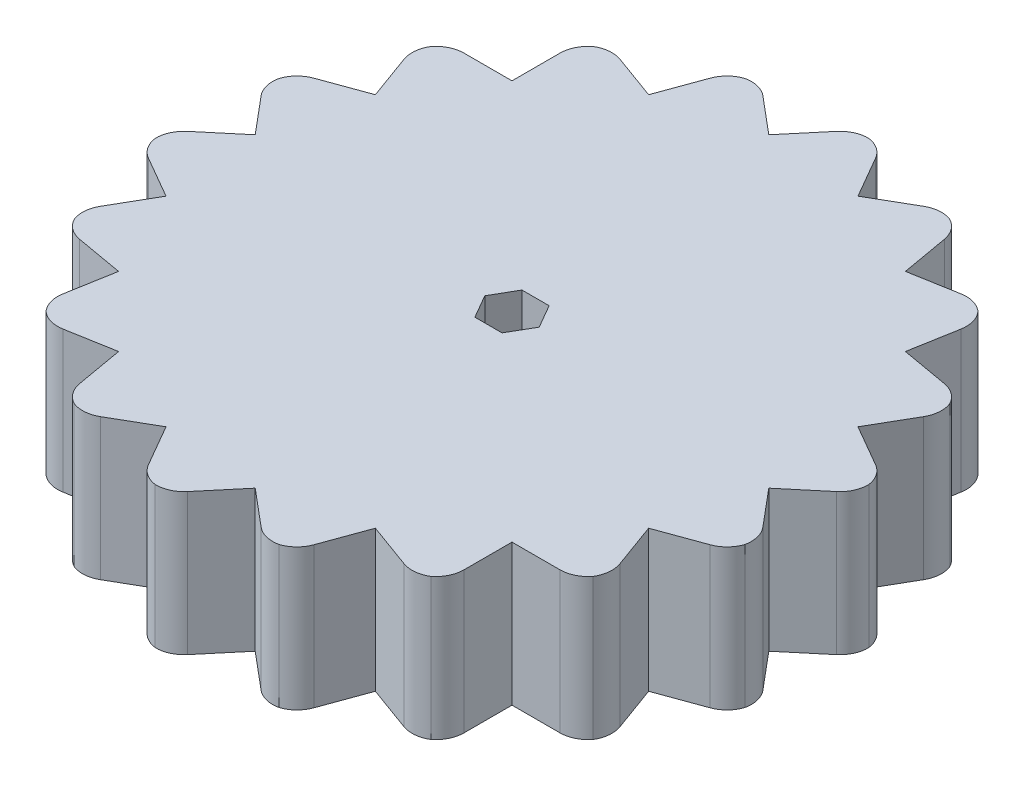
from build123d import *

# Parameters (mm, degrees)
SKETCH1_R           = 44.45
BOSS_EXTRUDE1_DEPTH = 19.05
SKETCH2_W           = 8.414535341
SKETCH2_H           = 8.414535341
CUT_EXTRUDE1_DEPTH  = 29.972
CIRPATTERN1_COUNT   = 18
CUT_EXTRUDE2_DEPTH  = 6.35
FILLET3_R           = 3.81
CUT_EXTRUDE6_DEPTH  = 25.908


with BuildPart() as part:
    # Sketch1 → Boss-Extrude1 (new body)
    with BuildSketch(Plane(origin=(0, 0, 0), x_dir=(1, 0, 0), z_dir=(0, 1, 0))):
        with Locations(Location((0, 0, 0), (0, 0, 270))):
            Circle(SKETCH1_R)
    extrude(amount=BOSS_EXTRUDE1_DEPTH)

    # Sketch2 → Cut-Extrude1 (cut)
    with BuildSketch(Plane(origin=(0, 19.05, 0), x_dir=(1, 0, 0), z_dir=(0, 1, 0))):
        with Locations((-31.148036033, 31.148036033)):
            Rectangle(SKETCH2_W, SKETCH2_H)
    cut_extrude1 = extrude(amount=-CUT_EXTRUDE1_DEPTH, mode=Mode.SUBTRACT)

    # CirPattern1: Cut-Extrude1 ×18 about axis
    cirpattern1_axis = Axis((0, 0, 0), (0, 1, 0))
    for i in range(1, CIRPATTERN1_COUNT):
        add(cut_extrude1.rotate(cirpattern1_axis, i * 360 / CIRPATTERN1_COUNT), mode=Mode.SUBTRACT)

    # Sketch4 → Cut-Extrude2 (cut)
    with BuildSketch(Plane.XZ):
        Polygon((4.671980957, -17.436070304), (14.786635004, -10.353713294), (17.982458197, 1.573261235), (12.764089347, 12.764089347), (1.573261235, 17.982458197), (-10.353713294, 14.786635004), (-17.436070304, 4.671980957), (-16.359896238, -7.628744902), (-7.628744902, -16.359896238), align=None)
    extrude(amount=-CUT_EXTRUDE2_DEPTH, mode=Mode.SUBTRACT)

    # Fillet3
    # the kernel refuses this fillet: 3.81 mm, written as the material it takes off along each edge
    with BuildSketch(Plane(origin=(-9.766541838, 24.122461368, -43.363777056), x_dir=(-0.9702942077465824, 0, 0.24192798600705953), z_dir=(0, -1, 0)), Plane(origin=(-24.008832539, 24.122461368, -37.408267269), x_dir=(-0.8290340625621466, 0, 0.5591981072139847), z_dir=(0, -1, 0)), Plane(origin=(-35.355303704, 24.122461368, -26.940768363), x_dir=(-0.5877801741930432, 0, 0.8090206838057948), z_dir=(0, -1, 0)), Plane(origin=(35.355303704, 24.122461368, 26.940768363), x_dir=(0.5877801741930427, 0, -0.8090206838057951), z_dir=(0, -1, 0)), Plane(origin=(42.437403453, 24.122461368, 13.223815189), x_dir=(0.2756313221047677, 0, -0.9612634260569668), z_dir=(0, -1, 0)), Plane(origin=(44.400926037, 24.122461368, -2.08812526), x_dir=(-0.06976273531441618, 0, -0.9975636123884285), z_dir=(0, -1, 0)), Plane(origin=(41.009041652, 24.122461368, -17.148206985), x_dir=(-0.40674237726635254, 0, -0.913542904594916), z_dir=(0, -1, 0)), Plane(origin=(32.670861615, 24.122461368, -30.139961867), x_dir=(-0.6946628856418128, 0, -0.7193354400499046), z_dir=(0, -1, 0)), Plane(origin=(20.392093497, 24.122461368, -39.496392529), x_dir=(-0.8987967978765562, 0, -0.43836550517444806), z_dir=(0, -1, 0)), Plane(origin=(5.653737948, 24.122461368, -44.088975348), x_dir=(-0.9945225514593977, 0, -0.10452222078911967), z_dir=(0, -1, 0))) as fillet3_piece_1:
        with BuildLine():
            CenterArc((1.942028067, -3.809007557), FILLET3_R, 88.692212078, 55.30814756)
            Line((-1.140340739, -1.569565093), (0, 0))
            ThreePointArc((0, 0), (1.014492274, 0.0115785), (2.028984547, 0))
        make_face()
    extrude(amount=29.194922737, mode=Mode.SUBTRACT)
    with BuildSketch(Plane(origin=(-13.223815189, 24.122461368, -42.437403453), x_dir=(-0.34202014332566844, 0, 0.9396926207859085), z_dir=(0, -1, 0)), Plane(origin=(-26.940768363, 24.122461368, -35.355303704), x_dir=(0, 0, 1), z_dir=(0, -1, 0)), Plane(origin=(37.408267269, 24.122461368, 24.008832539), x_dir=(-0.3420201433256682, 0, -0.9396926207859086), z_dir=(0, -1, 0)), Plane(origin=(43.363777056, 24.122461368, 9.766541838), x_dir=(-0.6427876096865393, 0, -0.7660444431189782), z_dir=(0, -1, 0)), Plane(origin=(44.088975348, 24.122461368, -5.653737948), x_dir=(-0.8660254037844388, 0, -0.4999999999999997), z_dir=(0, -1, 0)), Plane(origin=(39.496392529, 24.122461368, -20.392093497), x_dir=(-0.984807753012208, 0, -0.1736481776669302), z_dir=(0, -1, 0)), Plane(origin=(30.139961867, 24.122461368, -32.670861615), x_dir=(-0.9848077530122079, 0, 0.17364817766693105), z_dir=(0, -1, 0)), Plane(origin=(17.148206985, 24.122461368, -41.009041652), x_dir=(-0.8660254037844395, 0, 0.49999999999999856), z_dir=(0, -1, 0)), Plane(origin=(2.08812526, 24.122461368, -44.400926037), x_dir=(-0.6427876096865408, 0, 0.7660444431189768), z_dir=(0, -1, 0))) as fillet3_piece_2:
        with BuildLine():
            CenterArc((1.940080303, -3.81), FILLET3_R, 90, 55.30814756)
            ThreePointArc((-1.192596891, -1.641490466), (-0.605665691, -0.81393962), (0, 0))
            Line((0, 0), (1.940080303, 0))
        make_face()
    extrude(amount=29.194922737, mode=Mode.SUBTRACT)
    with BuildSketch(Plane(origin=(-37.408267269, 24.122461368, -24.008832539), x_dir=(0.559198107213983, 0, -0.8290340625621475), z_dir=(0, -1, 0)), Plane(origin=(-43.363777056, 24.122461368, -9.766541838), x_dir=(0.24192798600706303, 0, -0.9702942077465815), z_dir=(0, -1, 0)), Plane(origin=(-44.088975348, 24.122461368, 5.653737948), x_dir=(-0.1045222207891241, 0, -0.9945225514593973), z_dir=(0, -1, 0)), Plane(origin=(-39.496392529, 24.122461368, 20.392093497), x_dir=(-0.43836550517444245, 0, -0.8987967978765589), z_dir=(0, -1, 0)), Plane(origin=(-30.139961867, 24.122461368, 32.670861615), x_dir=(-0.7193354400499047, 0, -0.6946628856418126), z_dir=(0, -1, 0)), Plane(origin=(-17.148206985, 24.122461368, 41.009041652), x_dir=(-0.9135429045949142, 0, -0.4067423772663572), z_dir=(0, -1, 0)), Plane(origin=(-2.08812526, 24.122461368, 44.400926037), x_dir=(-0.9975636123884287, 0, -0.06976273531441333), z_dir=(0, -1, 0)), Plane(origin=(13.223815189, 24.122461368, 42.437403453), x_dir=(-0.9612634260569665, 0, 0.2756313221047693), z_dir=(0, -1, 0)), Plane(origin=(26.940768363, 24.122461368, 35.355303704), x_dir=(-0.809020683805795, 0, 0.587780174193043), z_dir=(0, -1, 0))) as fillet3_piece_3:
        with BuildLine():
            CenterArc((1.942028067, 3.809007557), FILLET3_R, 215.999640362, 55.30814756)
            Line((-1.140340739, 1.569565093), (0, 0))
            ThreePointArc((0, 0), (1.014492274, -0.0115785), (2.028984547, 0))
        make_face()
    extrude(amount=29.194922737, mode=Mode.SUBTRACT)
    with BuildSketch(Plane(origin=(-42.437403453, 24.122461368, -13.223815189), x_dir=(0.9396926207859084, 0, -0.3420201433256688), z_dir=(0, -1, 0)), Plane(origin=(-44.400926037, 24.122461368, 2.08812526), x_dir=(0.7660444431189783, 0, -0.6427876096865389), z_dir=(0, -1, 0)), Plane(origin=(-41.009041652, 24.122461368, 17.148206985), x_dir=(0.4999999999999989, 0, -0.8660254037844393), z_dir=(0, -1, 0)), Plane(origin=(-32.670861615, 24.122461368, 30.139961867), x_dir=(0.173648177666932, 0, -0.9848077530122078), z_dir=(0, -1, 0)), Plane(origin=(-20.392093497, 24.122461368, 39.496392529), x_dir=(-0.17364817766693083, 0, -0.9848077530122079), z_dir=(0, -1, 0)), Plane(origin=(-5.653737948, 24.122461368, 44.088975348), x_dir=(-0.49999999999999867, 0, -0.8660254037844395), z_dir=(0, -1, 0)), Plane(origin=(9.766541838, 24.122461368, 43.363777056), x_dir=(-0.7660444431189792, 0, -0.6427876096865378), z_dir=(0, -1, 0)), Plane(origin=(24.008832539, 24.122461368, 37.408267269), x_dir=(-0.9396926207859089, 0, -0.34202014332566766), z_dir=(0, -1, 0))) as fillet3_piece_4:
        with BuildLine():
            CenterArc((1.940080303, 3.81), FILLET3_R, 214.69185244, 55.30814756)
            ThreePointArc((-1.192596891, 1.641490466), (-0.605665691, 0.81393962), (0, 0))
            Line((0, 0), (1.940080303, 0))
        make_face()
    extrude(amount=29.194922737, mode=Mode.SUBTRACT)

    # Sketch6 → Cut-Extrude6 (cut)
    with BuildSketch(Plane(origin=(0, 19.05, 0), x_dir=(1, 0, 0), z_dir=(0, 1, 0))):
        Polygon((3.666174209, 0), (1.833087105, 3.175), (-1.833087105, 3.175), (-3.666174209, 0), (-1.833087105, -3.175), (1.833087105, -3.175), align=None)
    extrude(amount=-CUT_EXTRUDE6_DEPTH, mode=Mode.SUBTRACT)


solid = part.part
